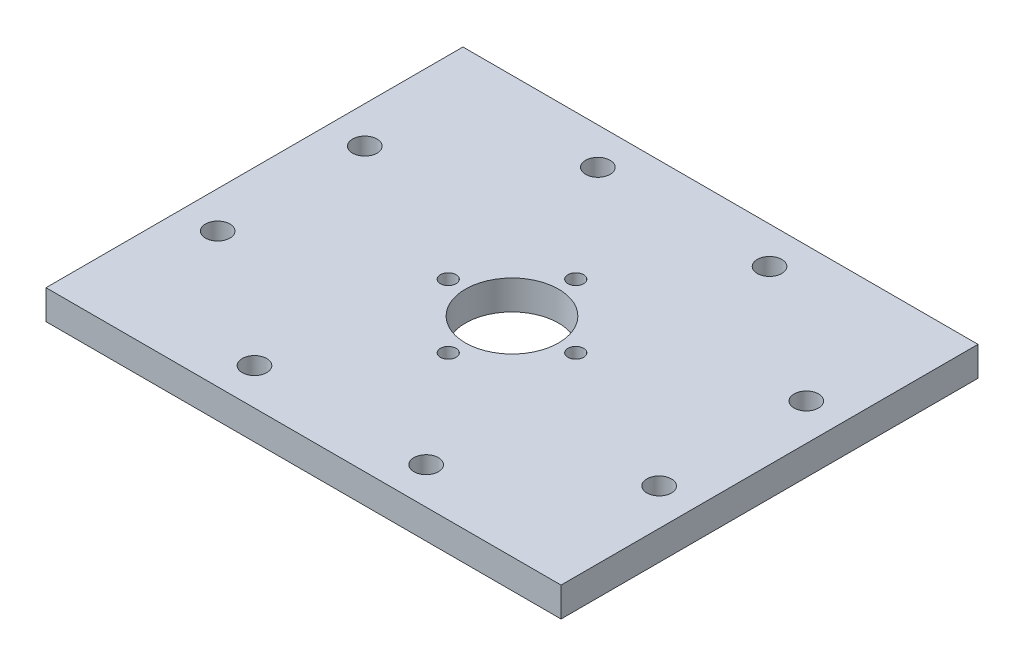
from build123d import *

# Parameters (mm, degrees)
SKETCH1_W                                       = 105
SKETCH1_H                                       = 85
SKETCH1_R                                       = 9.5
SKETCH1_R_2                                     = 2.5
BOSS_EXTRUDE1_DEPTH                             = 6
CSK_FOR_M3_FLAT_HEAD_MACHINE_SCREW1_D           = 3.2
CSK_FOR_M3_FLAT_HEAD_MACHINE_SCREW1_CSINK_D     = 6.3
CSK_FOR_M3_FLAT_HEAD_MACHINE_SCREW1_CSINK_ANGLE = 90


with BuildPart() as part:
    # Sketch1 → Boss-Extrude1 (new body)
    with BuildSketch(Plane(origin=(0, 0, 0), x_dir=(1, 0, 0), z_dir=(0, 1, 0))):
        Rectangle(SKETCH1_W, SKETCH1_H)
        Circle(SKETCH1_R, mode=Mode.SUBTRACT)
        with Locations((-17.5, 35)):
            Circle(SKETCH1_R_2, mode=Mode.SUBTRACT)
        with Locations((17.5, 35)):
            Circle(SKETCH1_R_2, mode=Mode.SUBTRACT)
        with Locations((17.5, -35)):
            Circle(SKETCH1_R_2, mode=Mode.SUBTRACT)
        with Locations((-17.5, -35)):
            Circle(SKETCH1_R_2, mode=Mode.SUBTRACT)
        with Locations((-45, 15)):
            Circle(SKETCH1_R_2, mode=Mode.SUBTRACT)
        with Locations((-45, -15)):
            Circle(SKETCH1_R_2, mode=Mode.SUBTRACT)
        with Locations((45, -15)):
            Circle(SKETCH1_R_2, mode=Mode.SUBTRACT)
        with Locations((45, 15)):
            Circle(SKETCH1_R_2, mode=Mode.SUBTRACT)
    extrude(amount=BOSS_EXTRUDE1_DEPTH)

    # CSK for M3 Flat Head Machine Screw1 (through all)
    with Locations(Plane(origin=(0, 0, 0), x_dir=(-1, 0, 0), z_dir=(0, -1, 0))):
        with Locations((-13, 0), (0, -13), (13, 0), (0, 13)):
            CounterSinkHole(CSK_FOR_M3_FLAT_HEAD_MACHINE_SCREW1_D / 2, CSK_FOR_M3_FLAT_HEAD_MACHINE_SCREW1_CSINK_D / 2, counter_sink_angle=CSK_FOR_M3_FLAT_HEAD_MACHINE_SCREW1_CSINK_ANGLE)


solid = part.part
